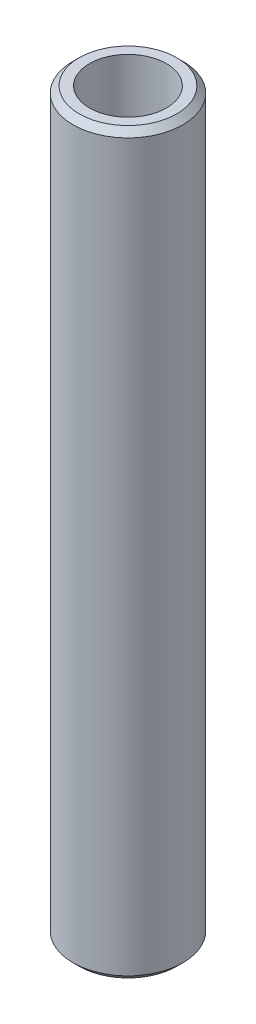
from build123d import *

# Parameters (mm, degrees)
SKETCH1_R           = 32.5
BOSS_EXTRUDE1_DEPTH = 436.233759187
SKETCH2_R           = 22.745655965
CUT_EXTRUDE1_DEPTH  = 439.648370172
CHAMFER1_SIZE       = 3.707340085


with BuildPart() as part:
    # Sketch1 → Boss-Extrude1 (new body)
    with BuildSketch(Plane(origin=(0, 0, 0), x_dir=(1, 0, 0), z_dir=(0, 1, 0))):
        Circle(SKETCH1_R)
    extrude(amount=BOSS_EXTRUDE1_DEPTH)

    # Sketch2 → Cut-Extrude1 (cut, through all)
    with BuildSketch(Plane(origin=(0, 0, 0), x_dir=(1, 0, 0), z_dir=(0, 1, 0))):
        Circle(SKETCH2_R)
    extrude(amount=CUT_EXTRUDE1_DEPTH, mode=Mode.SUBTRACT)

    # Chamfer1
    chamfer1_edges = [part.edges().sort_by_distance(p)[0] for p in [
        (-32.5, 436.233759187, 0),
        (-32.5, 0, 0),
    ]]
    chamfer(chamfer1_edges, length=CHAMFER1_SIZE)


solid = part.part
